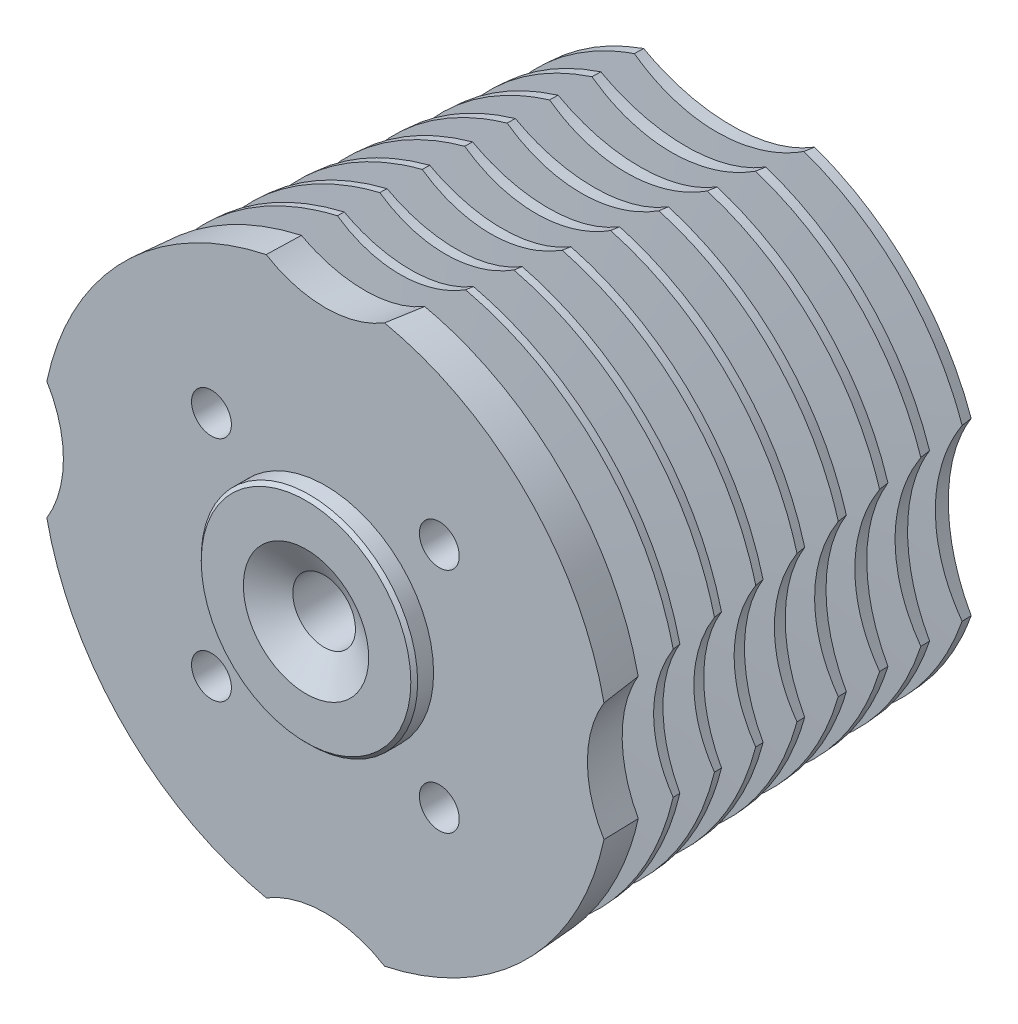
from build123d import *

# Parameters (mm, degrees)
ESQUISSE1_R                  = 9.5
BASE_EXTRUSION_DEPTH         = 1.7
ENL_V_MAT_EXTRU_1_DEPTH      = 32
R_P_TITION_LIN_AIRE1_COUNT   = 9
R_P_TITION_LIN_AIRE1_PITCH   = 4
CHANFREIN1_SIZE              = 0.3
ESQUISSE7_R                  = 1.75
ENL_V_MAT_EXTRU_2_DEPTH      = 48.117402337
R_P_TITION_CIRCULAIRE1_COUNT = 4
PER_AGE1_D                   = 5.5
PER_AGE1_DEPTH               = 100
PER_AGE1_CSINK_D             = 11
PER_AGE1_CSINK_ANGLE         = 120


with BuildPart() as part:
    # Esquisse1 → Base-Extrusion (new body)
    with BuildSketch(Plane.XY):
        Circle(ESQUISSE1_R)
    extrude(amount=BASE_EXTRUSION_DEPTH)

    # Esquisse2 for Boss.-Lissag → Boss.-Lissage1 section 0
    with BuildSketch(Plane(origin=(0, 0, 0), x_dir=(-1, 0, 0), z_dir=(0, 0, -1))):
        with BuildLine():
            # circular arc as an exact rational Bezier (weights 1, cos(half-angle), 1)
            Bezier((24.454545455, 5.19376613), (21.080458434, 21.080458434), (5.19376613, 24.454545455), weights=[1, 0.838580887, 1])
            Bezier((5.19376613, 24.454545455), (0, 21.29787234), (-5.19376613, 24.454545455), weights=[1, 0.854545455, 1])
            Bezier((-5.19376613, 24.454545455), (-21.080458434, 21.080458434), (-24.454545455, 5.19376613), weights=[1, 0.838580887, 1])
            Bezier((-24.454545455, 5.19376613), (-21.29787234, 0), (-24.454545455, -5.19376613), weights=[1, 0.854545455, 1])
            Bezier((-24.454545455, -5.19376613), (-21.080458434, -21.080458434), (-5.19376613, -24.454545455), weights=[1, 0.838580887, 1])
            Bezier((-5.19376613, -24.454545455), (0, -21.29787234), (5.19376613, -24.454545455), weights=[1, 0.854545455, 1])
            Bezier((5.19376613, -24.454545455), (21.080458434, -21.080458434), (24.454545455, -5.19376613), weights=[1, 0.838580887, 1])
            Bezier((24.454545455, -5.19376613), (21.29787234, 0), (24.454545455, 5.19376613), weights=[1, 0.854545455, 1])
        make_face()
    # Esquisse3 for Boss.-Lissag → Boss.-Lissage1 section 1
    with BuildSketch(Plane.XY.offset(-36)):
        with BuildLine():
            Bezier((7.535109702, -21.200757576), (17.617355868, -17.617355868), (21.200757576, -7.535109702), weights=[1, 0.903081183, 1])
            Bezier((21.200757576, -7.535109702), (16.388764045, 0), (21.200757576, 7.535109702), weights=[1, 0.84280303, 1])
            Bezier((21.200757576, 7.535109702), (17.617355868, 17.617355868), (7.535109702, 21.200757576), weights=[1, 0.903081183, 1])
            Bezier((7.535109702, 21.200757576), (0, 16.388764045), (-7.535109702, 21.200757576), weights=[1, 0.84280303, 1])
            Bezier((-7.535109702, 21.200757576), (-17.617355868, 17.617355868), (-21.200757576, 7.535109702), weights=[1, 0.903081183, 1])
            Bezier((-21.200757576, 7.535109702), (-16.388764045, 0), (-21.200757576, -7.535109702), weights=[1, 0.84280303, 1])
            Bezier((-21.200757576, -7.535109702), (-17.617355868, -17.617355868), (-7.535109702, -21.200757576), weights=[1, 0.903081183, 1])
            Bezier((-7.535109702, -21.200757576), (0, -16.388764045), (7.535109702, -21.200757576), weights=[1, 0.84280303, 1])
        make_face()
    loft()

    # Esquisse4 → Enlèv. mat.-Extru.1 (cut)
    with BuildSketch(Plane(origin=(0, 0, -36), x_dir=(-1, 0, 0), z_dir=(0, 0, -1))):
        with BuildLine():
            Line((-8.854894321, 14.51174857), (-2.872450001, 8.52930425))
            ThreePointArc((-2.872450001, 8.52930425), (0, 9), (2.872450001, 8.52930425))
            Line((2.872450001, 8.52930425), (8.854894321, 14.51174857))
            ThreePointArc((8.854894321, 14.51174857), (12.02081528, 12.02081528), (14.51174857, 8.854894321))
            Line((14.51174857, 8.854894321), (8.52930425, 2.872450001))
            ThreePointArc((8.52930425, 2.872450001), (9, 0), (8.52930425, -2.872450001))
            Line((8.52930425, -2.872450001), (14.51174857, -8.854894321))
            ThreePointArc((14.51174857, -8.854894321), (12.02081528, -12.02081528), (8.854894321, -14.51174857))
            Line((8.854894321, -14.51174857), (2.872450001, -8.52930425))
            ThreePointArc((2.872450001, -8.52930425), (0, -9), (-2.872450001, -8.52930425))
            Line((-2.872450001, -8.52930425), (-8.854894321, -14.51174857))
            ThreePointArc((-8.854894321, -14.51174857), (-12.02081528, -12.02081528), (-14.51174857, -8.854894321))
            Line((-14.51174857, -8.854894321), (-8.52930425, -2.872450001))
            ThreePointArc((-8.52930425, -2.872450001), (-9, 0), (-8.52930425, 2.872450001))
            Line((-8.52930425, 2.872450001), (-14.51174857, 8.854894321))
            ThreePointArc((-14.51174857, 8.854894321), (-12.02081528, 12.02081528), (-8.854894321, 14.51174857))
        make_face()
    extrude(amount=-ENL_V_MAT_EXTRU_1_DEPTH, mode=Mode.SUBTRACT)

    # Esquisse6 → Enlèvement de matière-Révolution2 (revolve, cut)
    with BuildSketch(Plane(origin=(0, 0, 0), x_dir=(1, 0, 0), z_dir=(0, 1, 0))):
        Polygon((-13, 38), (-29.975686528, 39), (-29.975686528, 35), (-13, 36), align=None)
    enl_vement_de_mati_re_r_volution2 = revolve(axis=Axis((0, 0, 0), (0, 0, -1)), mode=Mode.SUBTRACT)

    # Répétition linéaire1: Enlèvement de matière-Révolution2 ×9
    with Locations(*[(0, 0, i * R_P_TITION_LIN_AIRE1_PITCH) for i in range(1, R_P_TITION_LIN_AIRE1_COUNT)]):
        add(enl_vement_de_mati_re_r_volution2, mode=Mode.SUBTRACT)

    # Chanfrein1
    chanfrein1_edges = [part.edges().sort_by_distance(p)[0] for p in [
        (-9.5, 0, 1.7),
    ]]
    chamfer(chanfrein1_edges, length=CHANFREIN1_SIZE)

    # Esquisse7 → Enlèv. mat.-Extru.2 (cut, through all)
    with BuildSketch(Plane(origin=(0, 0, -4), x_dir=(-1, 0, 0), z_dir=(0, 0, -1))):
        with Locations((10, 10)):
            Circle(ESQUISSE7_R)
    enl_v_mat_extru_2 = extrude(amount=-ENL_V_MAT_EXTRU_2_DEPTH, mode=Mode.SUBTRACT)

    # Répétition circulaire1: Enlèv. mat.-Extru.2 ×4 about axis
    r_p_tition_circulaire1_axis = Axis((0, 0, 0), (0, 0, -1))
    for i in range(1, R_P_TITION_CIRCULAIRE1_COUNT):
        add(enl_v_mat_extru_2.rotate(r_p_tition_circulaire1_axis, i * 360 / R_P_TITION_CIRCULAIRE1_COUNT), mode=Mode.SUBTRACT)

    # Perçage1
    with Locations(Plane.XY.offset(1.7)):
        with Locations((0, 0)):
            CounterSinkHole(PER_AGE1_D / 2, PER_AGE1_CSINK_D / 2, depth=PER_AGE1_DEPTH, counter_sink_angle=PER_AGE1_CSINK_ANGLE)


solid = part.part
